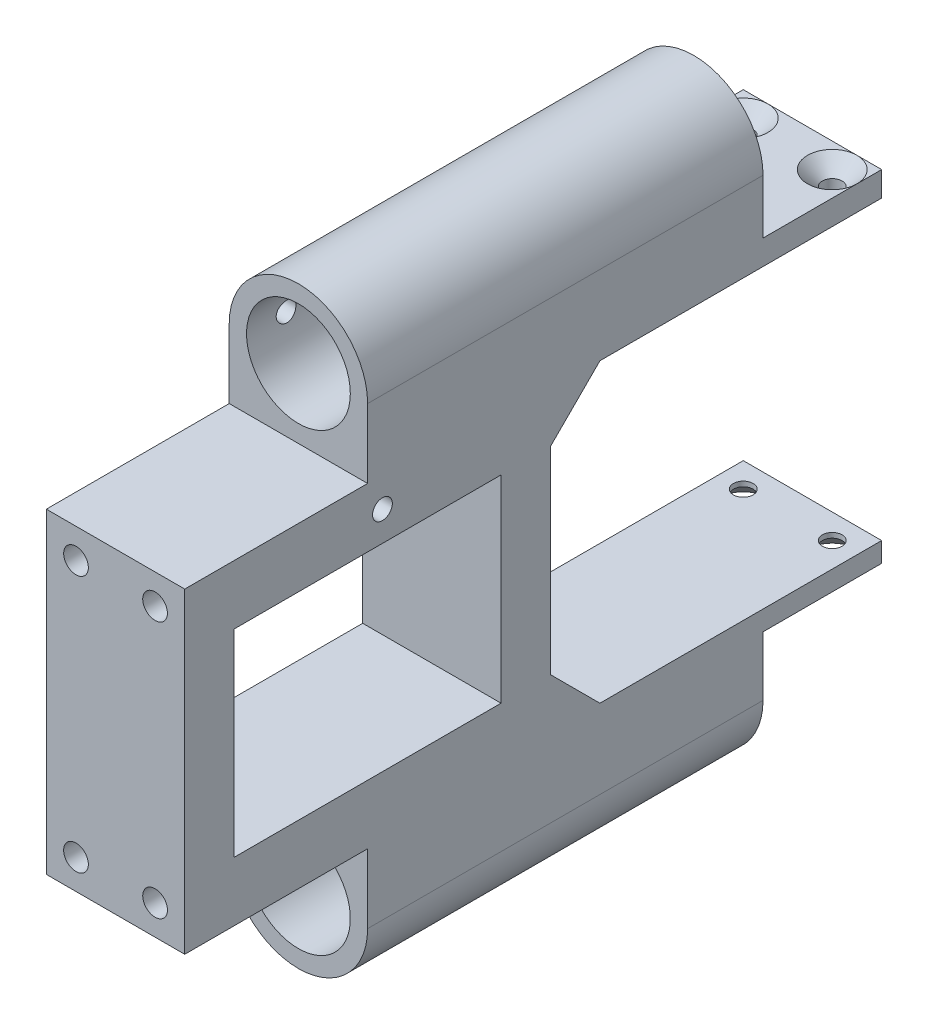
from build123d import *

# Parameters (mm, degrees)
SKETCH_1_W               = 28
SKETCH_1_H               = 64
EXTRUDE_1_DEPTH          = 74
SKETCH_2_R               = 2.5
CUT_EXTRUDE_1_DEPTH      = 10
CUT_EXTRUDE_2_DEPTH      = 99.833192805
CUT_EXTRUDE_2_DEPTH_BACK = 99.833192805
SKETCH_3_W               = 54
SKETCH_3_H               = 40
EXTRUDE_2_DEPTH          = 80
SKETCH_6_R               = 10.5
CUT_EXTRUDE_3_DEPTH      = 123.719191653
SKETCH_11_W              = 28
SKETCH_11_H              = 5
SKETCH_11_H_2            = 4
EXTRUDE_5_DEPTH          = 67
SKETCH_12_R              = 2
CUT_EXTRUDE_8_DEPTH      = 122.231184107
CHAMFER_1_SIZE           = 10
SKETCH_13_R              = 10.5
SKETCH_13_R_2            = 9.5
EXTRUDE_6_DEPTH          = 25
SKETCH_14_R              = 2
CUT_EXTRUDE_9_DEPTH      = 119.894911582
SKETCH_15_R              = 2
CUT_EXTRUDE_10_DEPTH     = 122.342490596
CHAMFER_2_SIZE           = 3


with BuildPart() as part:
    # 草图1 → 凸台-拉伸1 (new body)
    with BuildSketch(Plane.XY):
        with Locations((0, 32)):
            Rectangle(SKETCH_1_W, SKETCH_1_H)
    extrude(amount=EXTRUDE_1_DEPTH)

    # 草图2 → 切除-拉伸1 (cut)
    with BuildSketch(Plane.XY.offset(74)):
        with Locations((-8, 58)):
            Circle(SKETCH_2_R)
        with Locations((8, 58)):
            Circle(SKETCH_2_R)
        with Locations((-8, 6)):
            Circle(SKETCH_2_R)
        with Locations((8, 6)):
            Circle(SKETCH_2_R)
    extrude(amount=-CUT_EXTRUDE_1_DEPTH, mode=Mode.SUBTRACT)

    # 草图3 → 切除-拉伸2 (cut, two sides: drawn at the far end of the back side and taken through both)
    with BuildSketch(Plane(origin=(0, 0, 0), x_dir=(0, 0, -1), z_dir=(1, 0, 0)).offset(-CUT_EXTRUDE_2_DEPTH_BACK)):
        with Locations((-37, 32)):
            Rectangle(SKETCH_3_W, SKETCH_3_H)
    extrude(amount=CUT_EXTRUDE_2_DEPTH + CUT_EXTRUDE_2_DEPTH_BACK, mode=Mode.SUBTRACT)

    # 草图4 → 凸台-拉伸2 (add)
    with BuildSketch(Plane(origin=(0, 0, 37), x_dir=(-1, 0, 0), z_dir=(0, 0, -1))):
        with BuildLine():
            Line((-14, 2), (14, 2))
            Line((14, 2), (14, -14))
            ThreePointArc((14, -14), (0, -28), (-14, -14))
            Line((-14, -14), (-14, 2))
        make_face()
        with BuildLine():
            Line((14, 62), (14, 78))
            ThreePointArc((14, 78), (0, 92), (-14, 78))
            Line((-14, 78), (-14, 62))
            Line((-14, 62), (14, 62))
        make_face()
    extrude(amount=EXTRUDE_2_DEPTH)

    # 草图6 → 切除-拉伸3 (cut, through all)
    with BuildSketch(Plane(origin=(0, 0, 37), x_dir=(-1, 0, 0), z_dir=(0, 0, -1))):
        with Locations((0, -14)):
            Circle(SKETCH_6_R)
        with Locations(Location((0, 78, 0), (0, 0, 180))):
            Circle(SKETCH_6_R)
    extrude(amount=CUT_EXTRUDE_3_DEPTH, mode=Mode.SUBTRACT)

    # 草图11 → 凸台-拉伸5 (add)
    with BuildSketch(Plane(origin=(0, 0, 0), x_dir=(-1, 0, 0), z_dir=(0, 0, -1))):
        with Locations((0, 64.5)):
            Rectangle(SKETCH_11_W, SKETCH_11_H)
        Rectangle(SKETCH_11_W, SKETCH_11_H_2)
    extrude(amount=EXTRUDE_5_DEPTH)

    # 草图12 → 切除-拉伸8 (cut, through all)
    with BuildSketch(Plane(origin=(0, 67, 0), x_dir=(1, 0, 0), z_dir=(0, 1, 0))):
        with Locations(Location((-9, 62, 0), (0, 0, 270))):
            Circle(SKETCH_12_R)
        with Locations(Location((9, 62, 0), (0, 0, 270))):
            Circle(SKETCH_12_R)
    extrude(amount=-CUT_EXTRUDE_8_DEPTH, mode=Mode.SUBTRACT)

    # 倒角1
    chamfer_1_edges = [part.edges().sort_by_distance(p)[0] for p in [
        (0, 62, 0),
        (0, 2, 0),
    ]]
    chamfer(chamfer_1_edges, length=CHAMFER_1_SIZE)

    # 草图13 → 凸台-拉伸6 (add, symmetric)
    # profile 1 of 2: a face of its own
    with BuildSketch(Plane.XY.offset(-3)):
        with Locations((0, 78)):
            Circle(SKETCH_13_R)
        with Locations((0, 78)):
            Circle(SKETCH_13_R_2, mode=Mode.SUBTRACT)
    # profile 2 of 2: a face of its own
    with BuildSketch(Plane.XY.offset(-3)):
        with Locations(Location((0, -14, 0), (0, 0, 180))):
            Circle(SKETCH_13_R)
        with Locations(Location((0, -14, 0), (0, 0, 180))):
            Circle(SKETCH_13_R_2, mode=Mode.SUBTRACT)
    extrude(amount=EXTRUDE_6_DEPTH, both=True)

    # 草图14 → 切除-拉伸9 (cut, through all)
    with BuildSketch(Plane(origin=(0, 0, 0), x_dir=(0, 0, -1), z_dir=(1, 0, 0))):
        with Locations((-29, 78)):
            Circle(SKETCH_14_R)
        with Locations((35, 78)):
            Circle(SKETCH_14_R)
        with Locations((35, -14)):
            Circle(SKETCH_14_R)
        with Locations((-29, -14)):
            Circle(SKETCH_14_R)
    extrude(amount=-CUT_EXTRUDE_9_DEPTH, mode=Mode.SUBTRACT)

    # 草图15 → 切除-拉伸10 (cut, through all)
    with BuildSketch(Plane.ZY.offset(14)):
        with Locations(Location((34, 58, 0), (0, 0, 270))):
            Circle(SKETCH_15_R)
    extrude(amount=-CUT_EXTRUDE_10_DEPTH, mode=Mode.SUBTRACT)

    # 倒角2
    chamfer_2_edges = [part.edges().sort_by_distance(p)[0] for p in [
        (-9, -2, -64),
        (-9, 67, -64),
        (9, -2, -64),
        (9, 67, -64),
    ]]
    chamfer(chamfer_2_edges, length=CHAMFER_2_SIZE - 0.0001)  # a hair under: the kernel refuses the full size


solid = part.part
